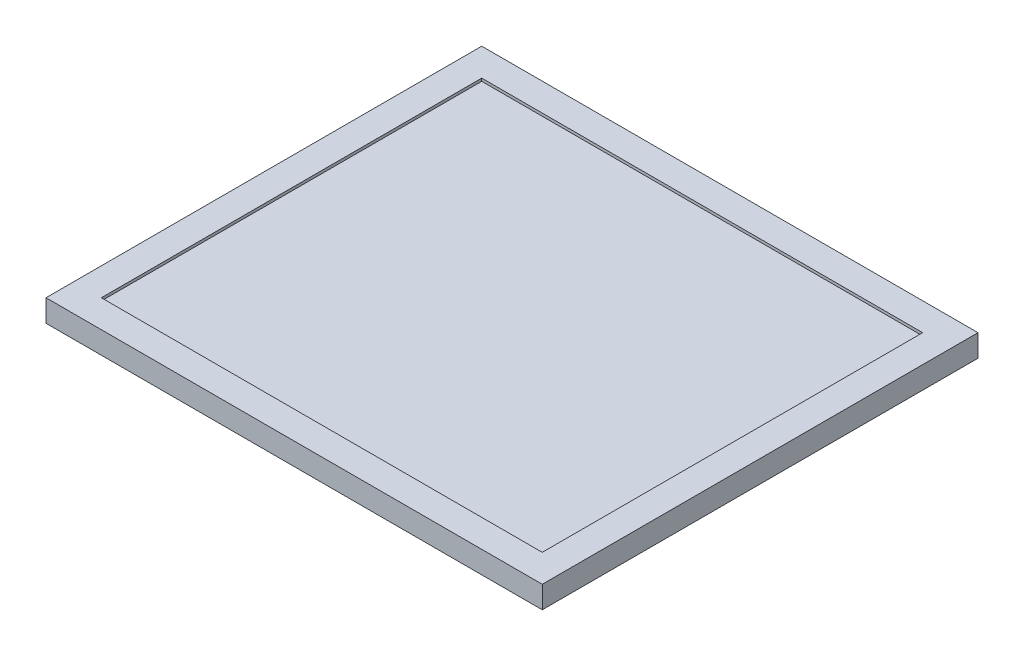
from build123d import *

# Parameters (mm, degrees)
SKETCH1_W                = 697.5
SKETCH1_H                = 610
SKETCH1_W_2              = 36.376888326
SKETCH1_H_2              = 77.239709443
BOSS_EXTRUDE1_DEPTH      = 1.5
SKETCH2_W                = 717.5
SKETCH2_H                = 630
SKETCH2_W_2              = 697.5
SKETCH2_H_2              = 610
BOSS_EXTRUDE3_DEPTH      = 30
SKETCH4_W                = 697.5
SKETCH4_H                = 610
BOSS_EXTRUDE4_DEPTH      = 18.5
BOSS_EXTRUDE5_DEPTH      = 2
BOSS_EXTRUDE5_DEPTH_BACK = 2
SKETCH5_W                = 717.5
SKETCH5_H                = 630
SKETCH5_W_2              = 637.5
SKETCH5_H_2              = 550


with BuildPart() as part:
    # Sketch1 → Boss-Extrude1 (new body)
    with BuildSketch(Plane(origin=(0, 0, 0), x_dir=(1, 0, 0), z_dir=(0, 1, 0))):
        Rectangle(SKETCH1_W, SKETCH1_H)
        Polygon((-328.709198227, 295), (-338.75, 284.959198227), (-338.75, 227.43860256), (-329.071687997, 217.760290557), (-318.709198227, 217.760290557), (-318.709198227, 295), align=None, mode=Mode.SUBTRACT)
        Polygon((-256.291508129, 285.321687997), (-256.291508129, 227.43860256), (-265.969820131, 217.760290557), (-276.332309901, 217.760290557), (-276.332309901, 295), (-265.969820131, 295), align=None, mode=Mode.SUBTRACT)
        with Locations((-297.520754064, 256.380145278)):
            Rectangle(SKETCH1_W_2, SKETCH1_H_2, mode=Mode.SUBTRACT)
        Polygon((-253.75, 284.959198227), (-253.75, 227.43860256), (-244.071687997, 217.760290557), (-233.709198227, 217.760290557), (-233.709198227, 295), (-243.709198227, 295), align=None, mode=Mode.SUBTRACT)
        with Locations((-212.520754064, 256.380145278)):
            Rectangle(SKETCH1_W_2, SKETCH1_H_2, mode=Mode.SUBTRACT)
        Polygon((-191.332309901, 295), (-191.332309901, 217.760290557), (-180.969820131, 217.760290557), (-171.291508129, 227.43860256), (-171.291508129, 285.321687997), (-180.969820131, 295), align=None, mode=Mode.SUBTRACT)
        Polygon((-168.75, 284.959198227), (-168.75, 227.43860256), (-159.071687997, 217.760290557), (-148.709198227, 217.760290557), (-148.709198227, 295), (-158.709198227, 295), align=None, mode=Mode.SUBTRACT)
        with Locations((-127.520754064, 256.380145278)):
            Rectangle(SKETCH1_W_2, SKETCH1_H_2, mode=Mode.SUBTRACT)
        Polygon((-106.332309901, 295), (-106.332309901, 217.760290557), (-95.969820131, 217.760290557), (-86.291508129, 227.43860256), (-86.291508129, 285.321687997), (-95.969820131, 295), align=None, mode=Mode.SUBTRACT)
        Polygon((-83.75, 284.959198227), (-83.75, 227.43860256), (-74.071687997, 217.760290557), (-63.709198227, 217.760290557), (-63.709198227, 295), (-73.709198227, 295), align=None, mode=Mode.SUBTRACT)
        with Locations((-42.520754064, 256.380145278)):
            Rectangle(SKETCH1_W_2, SKETCH1_H_2, mode=Mode.SUBTRACT)
        Polygon((-21.332309901, 295), (-21.332309901, 217.760290557), (-10.969820131, 217.760290557), (-1.291508129, 227.43860256), (-1.291508129, 285.321687997), (-10.969820131, 295), align=None, mode=Mode.SUBTRACT)
        Polygon((1.25, 284.959198227), (1.25, 227.43860256), (10.928312003, 217.760290557), (21.290801773, 217.760290557), (21.290801773, 295), (11.290801773, 295), align=None, mode=Mode.SUBTRACT)
        with Locations((42.479245936, 256.380145278)):
            Rectangle(SKETCH1_W_2, SKETCH1_H_2, mode=Mode.SUBTRACT)
        Polygon((63.667690099, 295), (63.667690099, 217.760290557), (74.030179869, 217.760290557), (83.708491871, 227.43860256), (83.708491871, 285.321687997), (74.030179869, 295), align=None, mode=Mode.SUBTRACT)
        Polygon((86.25, 284.959198227), (86.25, 227.43860256), (95.928312003, 217.760290557), (106.290801773, 217.760290557), (106.290801773, 295), (96.290801773, 295), align=None, mode=Mode.SUBTRACT)
        with Locations((127.479245936, 256.380145278)):
            Rectangle(SKETCH1_W_2, SKETCH1_H_2, mode=Mode.SUBTRACT)
        Polygon((148.667690099, 295), (148.667690099, 217.760290557), (159.030179869, 217.760290557), (168.708491871, 227.43860256), (168.708491871, 285.321687997), (159.030179869, 295), align=None, mode=Mode.SUBTRACT)
        Polygon((171.25, 284.959198227), (171.25, 227.43860256), (180.928312003, 217.760290557), (191.290801773, 217.760290557), (191.290801773, 295), (181.290801773, 295), align=None, mode=Mode.SUBTRACT)
        with Locations((212.479245936, 256.380145278)):
            Rectangle(SKETCH1_W_2, SKETCH1_H_2, mode=Mode.SUBTRACT)
        Polygon((233.667690099, 295), (233.667690099, 217.760290557), (244.030179869, 217.760290557), (253.708491871, 227.43860256), (253.708491871, 285.321687997), (244.030179869, 295), align=None, mode=Mode.SUBTRACT)
        Polygon((256.25, 284.959198227), (256.25, 227.43860256), (265.928312003, 217.760290557), (276.290801773, 217.760290557), (276.290801773, 295), (266.290801773, 295), align=None, mode=Mode.SUBTRACT)
        with Locations((297.479245936, 256.380145278)):
            Rectangle(SKETCH1_W_2, SKETCH1_H_2, mode=Mode.SUBTRACT)
        Polygon((318.667690099, 295), (318.667690099, 217.760290557), (329.030179869, 217.760290557), (338.708491871, 227.43860256), (338.708491871, 285.321687997), (329.030179869, 295), align=None, mode=Mode.SUBTRACT)
        Polygon((-253.75, 199.959198227), (-253.75, 142.43860256), (-244.071687997, 132.760290557), (-233.709198227, 132.760290557), (-233.709198227, 210), (-243.709198227, 210), align=None, mode=Mode.SUBTRACT)
        with Locations((-212.520754064, 171.380145279)):
            Rectangle(SKETCH1_W_2, SKETCH1_H_2, mode=Mode.SUBTRACT)
        Polygon((-191.332309901, 210), (-191.332309901, 132.760290557), (-180.969820131, 132.760290557), (-171.291508129, 142.43860256), (-171.291508129, 200.321687997), (-180.969820131, 210), align=None, mode=Mode.SUBTRACT)
        Polygon((-168.75, 199.959198227), (-168.75, 142.43860256), (-159.071687997, 132.760290557), (-148.709198227, 132.760290557), (-148.709198227, 210), (-158.709198227, 210), align=None, mode=Mode.SUBTRACT)
        with Locations((-127.520754064, 171.380145279)):
            Rectangle(SKETCH1_W_2, SKETCH1_H_2, mode=Mode.SUBTRACT)
        Polygon((-106.332309901, 210), (-106.332309901, 132.760290557), (-95.969820131, 132.760290557), (-86.291508129, 142.43860256), (-86.291508129, 200.321687997), (-95.969820131, 210), align=None, mode=Mode.SUBTRACT)
        Polygon((-83.75, 199.959198227), (-83.75, 142.43860256), (-74.071687997, 132.760290557), (-63.709198227, 132.760290557), (-63.709198227, 210), (-73.709198227, 210), align=None, mode=Mode.SUBTRACT)
        with Locations((-42.520754064, 171.380145279)):
            Rectangle(SKETCH1_W_2, SKETCH1_H_2, mode=Mode.SUBTRACT)
        Polygon((-21.332309901, 210), (-21.332309901, 132.760290557), (-10.969820131, 132.760290557), (-1.291508129, 142.43860256), (-1.291508129, 200.321687997), (-10.969820131, 210), align=None, mode=Mode.SUBTRACT)
        Polygon((1.25, 199.959198227), (1.25, 142.43860256), (10.928312003, 132.760290557), (21.290801773, 132.760290557), (21.290801773, 210), (11.290801773, 210), align=None, mode=Mode.SUBTRACT)
        with Locations((42.479245936, 171.380145279)):
            Rectangle(SKETCH1_W_2, SKETCH1_H_2, mode=Mode.SUBTRACT)
        Polygon((63.667690099, 210), (63.667690099, 132.760290557), (74.030179869, 132.760290557), (83.708491871, 142.43860256), (83.708491871, 200.321687997), (74.030179869, 210), align=None, mode=Mode.SUBTRACT)
        Polygon((86.25, 199.959198227), (86.25, 142.43860256), (95.928312003, 132.760290557), (106.290801773, 132.760290557), (106.290801773, 210), (96.290801773, 210), align=None, mode=Mode.SUBTRACT)
        with Locations((127.479245936, 171.380145279)):
            Rectangle(SKETCH1_W_2, SKETCH1_H_2, mode=Mode.SUBTRACT)
        Polygon((148.667690099, 210), (148.667690099, 132.760290557), (159.030179869, 132.760290557), (168.708491871, 142.43860256), (168.708491871, 200.321687997), (159.030179869, 210), align=None, mode=Mode.SUBTRACT)
        Polygon((171.25, 199.959198227), (171.25, 142.43860256), (180.928312003, 132.760290557), (191.290801773, 132.760290557), (191.290801773, 210), (181.290801773, 210), align=None, mode=Mode.SUBTRACT)
        with Locations((212.479245936, 171.380145279)):
            Rectangle(SKETCH1_W_2, SKETCH1_H_2, mode=Mode.SUBTRACT)
        Polygon((233.667690099, 210), (233.667690099, 132.760290557), (244.030179869, 132.760290557), (253.708491871, 142.43860256), (253.708491871, 200.321687997), (244.030179869, 210), align=None, mode=Mode.SUBTRACT)
        Polygon((256.25, 199.959198227), (256.25, 142.43860256), (265.928312003, 132.760290557), (276.290801773, 132.760290557), (276.290801773, 210), (266.290801773, 210), align=None, mode=Mode.SUBTRACT)
        with Locations((297.479245936, 171.380145279)):
            Rectangle(SKETCH1_W_2, SKETCH1_H_2, mode=Mode.SUBTRACT)
        Polygon((318.667690099, 210), (318.667690099, 132.760290557), (329.030179869, 132.760290557), (338.708491871, 142.43860256), (338.708491871, 200.321687997), (329.030179869, 210), align=None, mode=Mode.SUBTRACT)
        Polygon((-253.75, 114.959198227), (-253.75, 57.43860256), (-244.071687997, 47.760290557), (-233.709198227, 47.760290557), (-233.709198227, 125), (-243.709198227, 125), align=None, mode=Mode.SUBTRACT)
        with Locations((-212.520754064, 86.380145279)):
            Rectangle(SKETCH1_W_2, SKETCH1_H_2, mode=Mode.SUBTRACT)
        Polygon((-191.332309901, 125), (-191.332309901, 47.760290557), (-180.969820131, 47.760290557), (-171.291508129, 57.43860256), (-171.291508129, 115.321687997), (-180.969820131, 125), align=None, mode=Mode.SUBTRACT)
        Polygon((-168.75, 114.959198227), (-168.75, 57.43860256), (-159.071687997, 47.760290557), (-148.709198227, 47.760290557), (-148.709198227, 125), (-158.709198227, 125), align=None, mode=Mode.SUBTRACT)
        with Locations((-127.520754064, 86.380145279)):
            Rectangle(SKETCH1_W_2, SKETCH1_H_2, mode=Mode.SUBTRACT)
        Polygon((-106.332309901, 125), (-106.332309901, 47.760290557), (-95.969820131, 47.760290557), (-86.291508129, 57.43860256), (-86.291508129, 115.321687997), (-95.969820131, 125), align=None, mode=Mode.SUBTRACT)
        Polygon((-83.75, 114.959198227), (-83.75, 57.43860256), (-74.071687997, 47.760290557), (-63.709198227, 47.760290557), (-63.709198227, 125), (-73.709198227, 125), align=None, mode=Mode.SUBTRACT)
        with Locations((-42.520754064, 86.380145279)):
            Rectangle(SKETCH1_W_2, SKETCH1_H_2, mode=Mode.SUBTRACT)
        Polygon((-21.332309901, 125), (-21.332309901, 47.760290557), (-10.969820131, 47.760290557), (-1.291508129, 57.43860256), (-1.291508129, 115.321687997), (-10.969820131, 125), align=None, mode=Mode.SUBTRACT)
        Polygon((1.25, 114.959198227), (1.25, 57.43860256), (10.928312003, 47.760290557), (21.290801773, 47.760290557), (21.290801773, 125), (11.290801773, 125), align=None, mode=Mode.SUBTRACT)
        with Locations((42.479245936, 86.380145279)):
            Rectangle(SKETCH1_W_2, SKETCH1_H_2, mode=Mode.SUBTRACT)
        Polygon((63.667690099, 125), (63.667690099, 47.760290557), (74.030179869, 47.760290557), (83.708491871, 57.43860256), (83.708491871, 115.321687997), (74.030179869, 125), align=None, mode=Mode.SUBTRACT)
        Polygon((86.25, 114.959198227), (86.25, 57.43860256), (95.928312003, 47.760290557), (106.290801773, 47.760290557), (106.290801773, 125), (96.290801773, 125), align=None, mode=Mode.SUBTRACT)
        with Locations((127.479245936, 86.380145279)):
            Rectangle(SKETCH1_W_2, SKETCH1_H_2, mode=Mode.SUBTRACT)
        Polygon((148.667690099, 125), (148.667690099, 47.760290557), (159.030179869, 47.760290557), (168.708491871, 57.43860256), (168.708491871, 115.321687997), (159.030179869, 125), align=None, mode=Mode.SUBTRACT)
        Polygon((171.25, 114.959198227), (171.25, 57.43860256), (180.928312003, 47.760290557), (191.290801773, 47.760290557), (191.290801773, 125), (181.290801773, 125), align=None, mode=Mode.SUBTRACT)
        with Locations((212.479245936, 86.380145279)):
            Rectangle(SKETCH1_W_2, SKETCH1_H_2, mode=Mode.SUBTRACT)
        Polygon((233.667690099, 125), (233.667690099, 47.760290557), (244.030179869, 47.760290557), (253.708491871, 57.43860256), (253.708491871, 115.321687997), (244.030179869, 125), align=None, mode=Mode.SUBTRACT)
        Polygon((256.25, 114.959198227), (256.25, 57.43860256), (265.928312003, 47.760290557), (276.290801773, 47.760290557), (276.290801773, 125), (266.290801773, 125), align=None, mode=Mode.SUBTRACT)
        with Locations((297.479245936, 86.380145279)):
            Rectangle(SKETCH1_W_2, SKETCH1_H_2, mode=Mode.SUBTRACT)
        Polygon((318.667690099, 125), (318.667690099, 47.760290557), (329.030179869, 47.760290557), (338.708491871, 57.43860256), (338.708491871, 115.321687997), (329.030179869, 125), align=None, mode=Mode.SUBTRACT)
        Polygon((-253.75, 29.959198227), (-253.75, -27.56139744), (-244.071687997, -37.239709443), (-233.709198227, -37.239709443), (-233.709198227, 40), (-243.709198227, 40), align=None, mode=Mode.SUBTRACT)
        with Locations((-212.520754064, 1.380145278)):
            Rectangle(SKETCH1_W_2, SKETCH1_H_2, mode=Mode.SUBTRACT)
        Polygon((-191.332309901, 40), (-191.332309901, -37.239709443), (-180.969820131, -37.239709443), (-171.291508129, -27.56139744), (-171.291508129, 30.321687997), (-180.969820131, 40), align=None, mode=Mode.SUBTRACT)
        Polygon((-168.75, 29.959198227), (-168.75, -27.56139744), (-159.071687997, -37.239709443), (-148.709198227, -37.239709443), (-148.709198227, 40), (-158.709198227, 40), align=None, mode=Mode.SUBTRACT)
        with Locations((-127.520754064, 1.380145278)):
            Rectangle(SKETCH1_W_2, SKETCH1_H_2, mode=Mode.SUBTRACT)
        Polygon((-106.332309901, 40), (-106.332309901, -37.239709443), (-95.969820131, -37.239709443), (-86.291508129, -27.56139744), (-86.291508129, 30.321687997), (-95.969820131, 40), align=None, mode=Mode.SUBTRACT)
        Polygon((-83.75, 29.959198227), (-83.75, -27.56139744), (-74.071687997, -37.239709443), (-63.709198227, -37.239709443), (-63.709198227, 40), (-73.709198227, 40), align=None, mode=Mode.SUBTRACT)
        with Locations((-42.520754064, 1.380145278)):
            Rectangle(SKETCH1_W_2, SKETCH1_H_2, mode=Mode.SUBTRACT)
        Polygon((-21.332309901, 40), (-21.332309901, -37.239709443), (-10.969820131, -37.239709443), (-1.291508129, -27.56139744), (-1.291508129, 30.321687997), (-10.969820131, 40), align=None, mode=Mode.SUBTRACT)
        Polygon((1.25, 29.959198227), (1.25, -27.56139744), (10.928312003, -37.239709443), (21.290801773, -37.239709443), (21.290801773, 40), (11.290801773, 40), align=None, mode=Mode.SUBTRACT)
        with Locations((42.479245936, 1.380145278)):
            Rectangle(SKETCH1_W_2, SKETCH1_H_2, mode=Mode.SUBTRACT)
        Polygon((63.667690099, 40), (63.667690099, -37.239709443), (74.030179869, -37.239709443), (83.708491871, -27.56139744), (83.708491871, 30.321687997), (74.030179869, 40), align=None, mode=Mode.SUBTRACT)
        Polygon((86.25, 29.959198227), (86.25, -27.56139744), (95.928312003, -37.239709443), (106.290801773, -37.239709443), (106.290801773, 40), (96.290801773, 40), align=None, mode=Mode.SUBTRACT)
        with Locations((127.479245936, 1.380145278)):
            Rectangle(SKETCH1_W_2, SKETCH1_H_2, mode=Mode.SUBTRACT)
        Polygon((148.667690099, 40), (148.667690099, -37.239709443), (159.030179869, -37.239709443), (168.708491871, -27.56139744), (168.708491871, 30.321687997), (159.030179869, 40), align=None, mode=Mode.SUBTRACT)
        Polygon((171.25, 29.959198227), (171.25, -27.56139744), (180.928312003, -37.239709443), (191.290801773, -37.239709443), (191.290801773, 40), (181.290801773, 40), align=None, mode=Mode.SUBTRACT)
        with Locations((212.479245936, 1.380145278)):
            Rectangle(SKETCH1_W_2, SKETCH1_H_2, mode=Mode.SUBTRACT)
        Polygon((233.667690099, 40), (233.667690099, -37.239709443), (244.030179869, -37.239709443), (253.708491871, -27.56139744), (253.708491871, 30.321687997), (244.030179869, 40), align=None, mode=Mode.SUBTRACT)
        Polygon((256.25, 29.959198227), (256.25, -27.56139744), (265.928312003, -37.239709443), (276.290801773, -37.239709443), (276.290801773, 40), (266.290801773, 40), align=None, mode=Mode.SUBTRACT)
        with Locations((297.479245936, 1.380145278)):
            Rectangle(SKETCH1_W_2, SKETCH1_H_2, mode=Mode.SUBTRACT)
        Polygon((318.667690099, 40), (318.667690099, -37.239709443), (329.030179869, -37.239709443), (338.708491871, -27.56139744), (338.708491871, 30.321687997), (329.030179869, 40), align=None, mode=Mode.SUBTRACT)
        Polygon((-253.75, -55.040801773), (-253.75, -112.56139744), (-244.071687997, -122.239709443), (-233.709198227, -122.239709443), (-233.709198227, -45), (-243.709198227, -45), align=None, mode=Mode.SUBTRACT)
        with Locations((-212.520754064, -83.619854722)):
            Rectangle(SKETCH1_W_2, SKETCH1_H_2, mode=Mode.SUBTRACT)
        Polygon((-191.332309901, -45), (-191.332309901, -122.239709443), (-180.969820131, -122.239709443), (-171.291508129, -112.56139744), (-171.291508129, -54.678312003), (-180.969820131, -45), align=None, mode=Mode.SUBTRACT)
        Polygon((-168.75, -55.040801773), (-168.75, -112.56139744), (-159.071687997, -122.239709443), (-148.709198227, -122.239709443), (-148.709198227, -45), (-158.709198227, -45), align=None, mode=Mode.SUBTRACT)
        with Locations((-127.520754064, -83.619854722)):
            Rectangle(SKETCH1_W_2, SKETCH1_H_2, mode=Mode.SUBTRACT)
        Polygon((-106.332309901, -45), (-106.332309901, -122.239709443), (-95.969820131, -122.239709443), (-86.291508129, -112.56139744), (-86.291508129, -54.678312003), (-95.969820131, -45), align=None, mode=Mode.SUBTRACT)
        Polygon((-83.75, -55.040801773), (-83.75, -112.56139744), (-74.071687997, -122.239709443), (-63.709198227, -122.239709443), (-63.709198227, -45), (-73.709198227, -45), align=None, mode=Mode.SUBTRACT)
        with Locations((-42.520754064, -83.619854722)):
            Rectangle(SKETCH1_W_2, SKETCH1_H_2, mode=Mode.SUBTRACT)
        Polygon((-21.332309901, -45), (-21.332309901, -122.239709443), (-10.969820131, -122.239709443), (-1.291508129, -112.56139744), (-1.291508129, -54.678312003), (-10.969820131, -45), align=None, mode=Mode.SUBTRACT)
        Polygon((1.25, -55.040801773), (1.25, -112.56139744), (10.928312003, -122.239709443), (21.290801773, -122.239709443), (21.290801773, -45), (11.290801773, -45), align=None, mode=Mode.SUBTRACT)
        with Locations((42.479245936, -83.619854722)):
            Rectangle(SKETCH1_W_2, SKETCH1_H_2, mode=Mode.SUBTRACT)
        Polygon((63.667690099, -45), (63.667690099, -122.239709443), (74.030179869, -122.239709443), (83.708491871, -112.56139744), (83.708491871, -54.678312003), (74.030179869, -45), align=None, mode=Mode.SUBTRACT)
        Polygon((86.25, -55.040801773), (86.25, -112.56139744), (95.928312003, -122.239709443), (106.290801773, -122.239709443), (106.290801773, -45), (96.290801773, -45), align=None, mode=Mode.SUBTRACT)
        with Locations((127.479245936, -83.619854722)):
            Rectangle(SKETCH1_W_2, SKETCH1_H_2, mode=Mode.SUBTRACT)
        Polygon((148.667690099, -45), (148.667690099, -122.239709443), (159.030179869, -122.239709443), (168.708491871, -112.56139744), (168.708491871, -54.678312003), (159.030179869, -45), align=None, mode=Mode.SUBTRACT)
        Polygon((171.25, -55.040801773), (171.25, -112.56139744), (180.928312003, -122.239709443), (191.290801773, -122.239709443), (191.290801773, -45), (181.290801773, -45), align=None, mode=Mode.SUBTRACT)
        with Locations((212.479245936, -83.619854722)):
            Rectangle(SKETCH1_W_2, SKETCH1_H_2, mode=Mode.SUBTRACT)
        Polygon((233.667690099, -45), (233.667690099, -122.239709443), (244.030179869, -122.239709443), (253.708491871, -112.56139744), (253.708491871, -54.678312003), (244.030179869, -45), align=None, mode=Mode.SUBTRACT)
        Polygon((256.25, -55.040801773), (256.25, -112.56139744), (265.928312003, -122.239709443), (276.290801773, -122.239709443), (276.290801773, -45), (266.290801773, -45), align=None, mode=Mode.SUBTRACT)
        with Locations((297.479245936, -83.619854722)):
            Rectangle(SKETCH1_W_2, SKETCH1_H_2, mode=Mode.SUBTRACT)
        Polygon((318.667690099, -45), (318.667690099, -122.239709443), (329.030179869, -122.239709443), (338.708491871, -112.56139744), (338.708491871, -54.678312003), (329.030179869, -45), align=None, mode=Mode.SUBTRACT)
        Polygon((-253.75, -140.040801773), (-253.75, -197.56139744), (-244.071687997, -207.239709443), (-233.709198227, -207.239709443), (-233.709198227, -130), (-243.709198227, -130), align=None, mode=Mode.SUBTRACT)
        with Locations((-212.520754064, -168.619854722)):
            Rectangle(SKETCH1_W_2, SKETCH1_H_2, mode=Mode.SUBTRACT)
        Polygon((-191.332309901, -130), (-191.332309901, -207.239709443), (-180.969820131, -207.239709443), (-171.291508129, -197.56139744), (-171.291508129, -139.678312003), (-180.969820131, -130), align=None, mode=Mode.SUBTRACT)
        Polygon((-168.75, -140.040801773), (-168.75, -197.56139744), (-159.071687997, -207.239709443), (-148.709198227, -207.239709443), (-148.709198227, -130), (-158.709198227, -130), align=None, mode=Mode.SUBTRACT)
        with Locations((-127.520754064, -168.619854722)):
            Rectangle(SKETCH1_W_2, SKETCH1_H_2, mode=Mode.SUBTRACT)
        Polygon((-106.332309901, -130), (-106.332309901, -207.239709443), (-95.969820131, -207.239709443), (-86.291508129, -197.56139744), (-86.291508129, -139.678312003), (-95.969820131, -130), align=None, mode=Mode.SUBTRACT)
        Polygon((-83.75, -140.040801773), (-83.75, -197.56139744), (-74.071687997, -207.239709443), (-63.709198227, -207.239709443), (-63.709198227, -130), (-73.709198227, -130), align=None, mode=Mode.SUBTRACT)
        with Locations((-42.520754064, -168.619854722)):
            Rectangle(SKETCH1_W_2, SKETCH1_H_2, mode=Mode.SUBTRACT)
        Polygon((-21.332309901, -130), (-21.332309901, -207.239709443), (-10.969820131, -207.239709443), (-1.291508129, -197.56139744), (-1.291508129, -139.678312003), (-10.969820131, -130), align=None, mode=Mode.SUBTRACT)
        Polygon((1.25, -140.040801773), (1.25, -197.56139744), (10.928312003, -207.239709443), (21.290801773, -207.239709443), (21.290801773, -130), (11.290801773, -130), align=None, mode=Mode.SUBTRACT)
        with Locations((42.479245936, -168.619854722)):
            Rectangle(SKETCH1_W_2, SKETCH1_H_2, mode=Mode.SUBTRACT)
        Polygon((63.667690099, -130), (63.667690099, -207.239709443), (74.030179869, -207.239709443), (83.708491871, -197.56139744), (83.708491871, -139.678312003), (74.030179869, -130), align=None, mode=Mode.SUBTRACT)
        Polygon((86.25, -140.040801773), (86.25, -197.56139744), (95.928312003, -207.239709443), (106.290801773, -207.239709443), (106.290801773, -130), (96.290801773, -130), align=None, mode=Mode.SUBTRACT)
        with Locations((127.479245936, -168.619854722)):
            Rectangle(SKETCH1_W_2, SKETCH1_H_2, mode=Mode.SUBTRACT)
        Polygon((148.667690099, -130), (148.667690099, -207.239709443), (159.030179869, -207.239709443), (168.708491871, -197.56139744), (168.708491871, -139.678312003), (159.030179869, -130), align=None, mode=Mode.SUBTRACT)
        Polygon((171.25, -140.040801773), (171.25, -197.56139744), (180.928312003, -207.239709443), (191.290801773, -207.239709443), (191.290801773, -130), (181.290801773, -130), align=None, mode=Mode.SUBTRACT)
        with Locations((212.479245936, -168.619854722)):
            Rectangle(SKETCH1_W_2, SKETCH1_H_2, mode=Mode.SUBTRACT)
        Polygon((233.667690099, -130), (233.667690099, -207.239709443), (244.030179869, -207.239709443), (253.708491871, -197.56139744), (253.708491871, -139.678312003), (244.030179869, -130), align=None, mode=Mode.SUBTRACT)
        Polygon((256.25, -140.040801773), (256.25, -197.56139744), (265.928312003, -207.239709443), (276.290801773, -207.239709443), (276.290801773, -130), (266.290801773, -130), align=None, mode=Mode.SUBTRACT)
        with Locations((297.479245936, -168.619854722)):
            Rectangle(SKETCH1_W_2, SKETCH1_H_2, mode=Mode.SUBTRACT)
        Polygon((318.667690099, -130), (318.667690099, -207.239709443), (329.030179869, -207.239709443), (338.708491871, -197.56139744), (338.708491871, -139.678312003), (329.030179869, -130), align=None, mode=Mode.SUBTRACT)
        Polygon((-253.75, -225.040801773), (-253.75, -282.56139744), (-244.071687997, -292.239709443), (-233.709198227, -292.239709443), (-233.709198227, -215), (-243.709198227, -215), align=None, mode=Mode.SUBTRACT)
        with Locations((-212.520754064, -253.619854722)):
            Rectangle(SKETCH1_W_2, SKETCH1_H_2, mode=Mode.SUBTRACT)
        Polygon((-191.332309901, -215), (-191.332309901, -292.239709443), (-180.969820131, -292.239709443), (-171.291508129, -282.56139744), (-171.291508129, -224.678312003), (-180.969820131, -215), align=None, mode=Mode.SUBTRACT)
        Polygon((-168.75, -225.040801773), (-168.75, -282.56139744), (-159.071687997, -292.239709443), (-148.709198227, -292.239709443), (-148.709198227, -215), (-158.709198227, -215), align=None, mode=Mode.SUBTRACT)
        with Locations((-127.520754064, -253.619854722)):
            Rectangle(SKETCH1_W_2, SKETCH1_H_2, mode=Mode.SUBTRACT)
        Polygon((-106.332309901, -215), (-106.332309901, -292.239709443), (-95.969820131, -292.239709443), (-86.291508129, -282.56139744), (-86.291508129, -224.678312003), (-95.969820131, -215), align=None, mode=Mode.SUBTRACT)
        Polygon((-83.75, -225.040801773), (-83.75, -282.56139744), (-74.071687997, -292.239709443), (-63.709198227, -292.239709443), (-63.709198227, -215), (-73.709198227, -215), align=None, mode=Mode.SUBTRACT)
        with Locations((-42.520754064, -253.619854722)):
            Rectangle(SKETCH1_W_2, SKETCH1_H_2, mode=Mode.SUBTRACT)
        Polygon((-21.332309901, -215), (-21.332309901, -292.239709443), (-10.969820131, -292.239709443), (-1.291508129, -282.56139744), (-1.291508129, -224.678312003), (-10.969820131, -215), align=None, mode=Mode.SUBTRACT)
        Polygon((1.25, -225.040801773), (1.25, -282.56139744), (10.928312003, -292.239709443), (21.290801773, -292.239709443), (21.290801773, -215), (11.290801773, -215), align=None, mode=Mode.SUBTRACT)
        with Locations((42.479245936, -253.619854722)):
            Rectangle(SKETCH1_W_2, SKETCH1_H_2, mode=Mode.SUBTRACT)
        Polygon((63.667690099, -215), (63.667690099, -292.239709443), (74.030179869, -292.239709443), (83.708491871, -282.56139744), (83.708491871, -224.678312003), (74.030179869, -215), align=None, mode=Mode.SUBTRACT)
        Polygon((86.25, -225.040801773), (86.25, -282.56139744), (95.928312003, -292.239709443), (106.290801773, -292.239709443), (106.290801773, -215), (96.290801773, -215), align=None, mode=Mode.SUBTRACT)
        with Locations((127.479245936, -253.619854722)):
            Rectangle(SKETCH1_W_2, SKETCH1_H_2, mode=Mode.SUBTRACT)
        Polygon((148.667690099, -215), (148.667690099, -292.239709443), (159.030179869, -292.239709443), (168.708491871, -282.56139744), (168.708491871, -224.678312003), (159.030179869, -215), align=None, mode=Mode.SUBTRACT)
        Polygon((171.25, -225.040801773), (171.25, -282.56139744), (180.928312003, -292.239709443), (191.290801773, -292.239709443), (191.290801773, -215), (181.290801773, -215), align=None, mode=Mode.SUBTRACT)
        with Locations((212.479245936, -253.619854722)):
            Rectangle(SKETCH1_W_2, SKETCH1_H_2, mode=Mode.SUBTRACT)
        Polygon((233.667690099, -215), (233.667690099, -292.239709443), (244.030179869, -292.239709443), (253.708491871, -282.56139744), (253.708491871, -224.678312003), (244.030179869, -215), align=None, mode=Mode.SUBTRACT)
        Polygon((256.25, -225.040801773), (256.25, -282.56139744), (265.928312003, -292.239709443), (276.290801773, -292.239709443), (276.290801773, -215), (266.290801773, -215), align=None, mode=Mode.SUBTRACT)
        with Locations((297.479245936, -253.619854722)):
            Rectangle(SKETCH1_W_2, SKETCH1_H_2, mode=Mode.SUBTRACT)
        Polygon((318.667690099, -215), (318.667690099, -292.239709443), (329.030179869, -292.239709443), (338.708491871, -282.56139744), (338.708491871, -224.678312003), (329.030179869, -215), align=None, mode=Mode.SUBTRACT)
        Polygon((-338.75, 199.959198227), (-338.75, 142.43860256), (-329.071687997, 132.760290557), (-318.709198227, 132.760290557), (-318.709198227, 210), (-328.709198227, 210), align=None, mode=Mode.SUBTRACT)
        with Locations((-297.520754064, 171.380145279)):
            Rectangle(SKETCH1_W_2, SKETCH1_H_2, mode=Mode.SUBTRACT)
        Polygon((-276.332309901, 210), (-276.332309901, 132.760290557), (-265.969820131, 132.760290557), (-256.291508129, 142.43860256), (-256.291508129, 200.321687997), (-265.969820131, 210), align=None, mode=Mode.SUBTRACT)
        Polygon((-338.75, 114.959198227), (-338.75, 57.43860256), (-329.071687997, 47.760290557), (-318.709198227, 47.760290557), (-318.709198227, 125), (-328.709198227, 125), align=None, mode=Mode.SUBTRACT)
        with Locations((-297.520754064, 86.380145279)):
            Rectangle(SKETCH1_W_2, SKETCH1_H_2, mode=Mode.SUBTRACT)
        Polygon((-276.332309901, 125), (-276.332309901, 47.760290557), (-265.969820131, 47.760290557), (-256.291508129, 57.43860256), (-256.291508129, 115.321687997), (-265.969820131, 125), align=None, mode=Mode.SUBTRACT)
        Polygon((-338.75, 29.959198227), (-338.75, -27.56139744), (-329.071687997, -37.239709443), (-318.709198227, -37.239709443), (-318.709198227, 40), (-328.709198227, 40), align=None, mode=Mode.SUBTRACT)
        with Locations((-297.520754064, 1.380145278)):
            Rectangle(SKETCH1_W_2, SKETCH1_H_2, mode=Mode.SUBTRACT)
        Polygon((-276.332309901, 40), (-276.332309901, -37.239709443), (-265.969820131, -37.239709443), (-256.291508129, -27.56139744), (-256.291508129, 30.321687997), (-265.969820131, 40), align=None, mode=Mode.SUBTRACT)
        Polygon((-338.75, -55.040801773), (-338.75, -112.56139744), (-329.071687997, -122.239709443), (-318.709198227, -122.239709443), (-318.709198227, -45), (-328.709198227, -45), align=None, mode=Mode.SUBTRACT)
        with Locations((-297.520754064, -83.619854722)):
            Rectangle(SKETCH1_W_2, SKETCH1_H_2, mode=Mode.SUBTRACT)
        Polygon((-276.332309901, -45), (-276.332309901, -122.239709443), (-265.969820131, -122.239709443), (-256.291508129, -112.56139744), (-256.291508129, -54.678312003), (-265.969820131, -45), align=None, mode=Mode.SUBTRACT)
        Polygon((-338.75, -140.040801773), (-338.75, -197.56139744), (-329.071687997, -207.239709443), (-318.709198227, -207.239709443), (-318.709198227, -130), (-328.709198227, -130), align=None, mode=Mode.SUBTRACT)
        with Locations((-297.520754064, -168.619854722)):
            Rectangle(SKETCH1_W_2, SKETCH1_H_2, mode=Mode.SUBTRACT)
        Polygon((-276.332309901, -130), (-276.332309901, -207.239709443), (-265.969820131, -207.239709443), (-256.291508129, -197.56139744), (-256.291508129, -139.678312003), (-265.969820131, -130), align=None, mode=Mode.SUBTRACT)
        Polygon((-338.75, -225.040801773), (-338.75, -282.56139744), (-329.071687997, -292.239709443), (-318.709198227, -292.239709443), (-318.709198227, -215), (-328.709198227, -215), align=None, mode=Mode.SUBTRACT)
        with Locations((-297.520754064, -253.619854722)):
            Rectangle(SKETCH1_W_2, SKETCH1_H_2, mode=Mode.SUBTRACT)
        Polygon((-276.332309901, -215), (-276.332309901, -292.239709443), (-265.969820131, -292.239709443), (-256.291508129, -282.56139744), (-256.291508129, -224.678312003), (-265.969820131, -215), align=None, mode=Mode.SUBTRACT)
    extrude(amount=BOSS_EXTRUDE1_DEPTH)

    # Sketch2 → Boss-Extrude3 (add)
    with BuildSketch(Plane(origin=(0, 0, 0), x_dir=(1, 0, 0), z_dir=(0, 1, 0))):
        Rectangle(SKETCH2_W, SKETCH2_H)
        Rectangle(SKETCH2_W_2, SKETCH2_H_2, mode=Mode.SUBTRACT)
    extrude(amount=BOSS_EXTRUDE3_DEPTH)

    # Sketch4 → Boss-Extrude4 (add)
    with BuildSketch(Plane(origin=(0, 20, 0), x_dir=(1, 0, 0), z_dir=(0, 1, 0))):
        Rectangle(SKETCH4_W, SKETCH4_H)
    extrude(amount=-BOSS_EXTRUDE4_DEPTH)

    # Sketch5 → Boss-Extrude5 (add, two sides: drawn at the far end of the back side and taken through both)
    with BuildSketch(Plane(origin=(0, 30, 0), x_dir=(1, 0, 0), z_dir=(0, 1, 0)).offset(-BOSS_EXTRUDE5_DEPTH_BACK)):
        Rectangle(SKETCH5_W, SKETCH5_H)
        Rectangle(SKETCH5_W_2, SKETCH5_H_2, mode=Mode.SUBTRACT)
    extrude(amount=BOSS_EXTRUDE5_DEPTH + BOSS_EXTRUDE5_DEPTH_BACK)


solid = part.part
